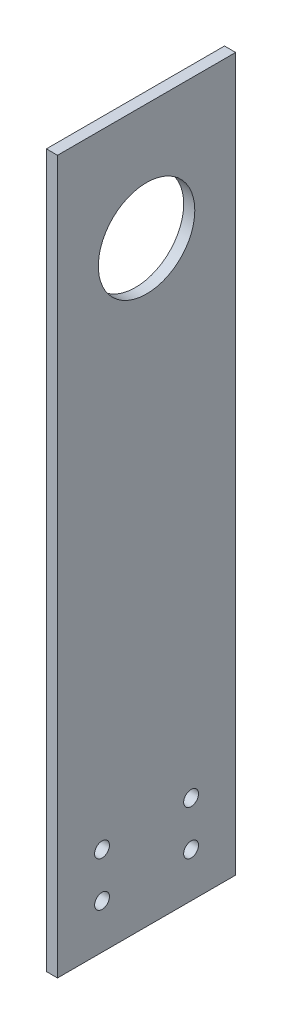
from build123d import *

# Parameters (mm, degrees)
SKETCH1_W           = 76.2
SKETCH1_H           = 304.8
BOSS_EXTRUDE1_DEPTH = 4.7625
CUT_EXTRUDE1_REACH  = 159.163
SKETCH2_R           = 20.6375
CUT_EXTRUDE2_REACH  = 159.163
SKETCH4_R           = 3.175


with BuildPart() as part:
    # Sketch1 → Boss-Extrude1 (new body)
    with BuildSketch(Plane(origin=(0, 0, 0), x_dir=(0, 0, -1), z_dir=(1, 0, 0))):
        Rectangle(SKETCH1_W, SKETCH1_H)
    extrude(amount=BOSS_EXTRUDE1_DEPTH)

    # Sketch2 → Cut-Extrude1 (cut, up to next)
    with BuildSketch(Plane(origin=(4.7625, 0, 0), x_dir=(0, 0, -1), z_dir=(1, 0, 0)), mode=Mode.PRIVATE) as cut_extrude1_sk1:
        with Locations((0, 102.616)):
            Circle(SKETCH2_R)
    cut_extrude1_tool1 = extrude(cut_extrude1_sk1.sketch, amount=-CUT_EXTRUDE1_REACH, mode=Mode.PRIVATE) & part.part
    add(cut_extrude1_tool1.solids().sort_by_distance((4.7625, 102.616, 0))[0], mode=Mode.SUBTRACT)

    # Sketch4 → Cut-Extrude2 (cut, up to next)
    with BuildSketch(Plane(origin=(4.7625, 0, 0), x_dir=(0, 0, -1), z_dir=(1, 0, 0)), mode=Mode.PRIVATE) as cut_extrude2_sk1:
        with Locations((-19.05, -114.3)):
            Circle(SKETCH4_R)
    cut_extrude2_tool1 = extrude(cut_extrude2_sk1.sketch, amount=-CUT_EXTRUDE2_REACH, mode=Mode.PRIVATE) & part.part
    # Sketch4 → Cut-Extrude2 (cut, up to next)
    with BuildSketch(Plane(origin=(4.7625, 0, 0), x_dir=(0, 0, -1), z_dir=(1, 0, 0)), mode=Mode.PRIVATE) as cut_extrude2_sk2:
        with Locations((19.05, -114.3)):
            Circle(SKETCH4_R)
    cut_extrude2_tool2 = extrude(cut_extrude2_sk2.sketch, amount=-CUT_EXTRUDE2_REACH, mode=Mode.PRIVATE) & part.part
    # Sketch4 → Cut-Extrude2 (cut, up to next)
    with BuildSketch(Plane(origin=(4.7625, 0, 0), x_dir=(0, 0, -1), z_dir=(1, 0, 0)), mode=Mode.PRIVATE) as cut_extrude2_sk3:
        with Locations((19.05, -133.35)):
            Circle(SKETCH4_R)
    cut_extrude2_tool3 = extrude(cut_extrude2_sk3.sketch, amount=-CUT_EXTRUDE2_REACH, mode=Mode.PRIVATE) & part.part
    # Sketch4 → Cut-Extrude2 (cut, up to next)
    with BuildSketch(Plane(origin=(4.7625, 0, 0), x_dir=(0, 0, -1), z_dir=(1, 0, 0)), mode=Mode.PRIVATE) as cut_extrude2_sk4:
        with Locations((-19.05, -133.35)):
            Circle(SKETCH4_R)
    cut_extrude2_tool4 = extrude(cut_extrude2_sk4.sketch, amount=-CUT_EXTRUDE2_REACH, mode=Mode.PRIVATE) & part.part
    add(cut_extrude2_tool1.solids().sort_by_distance((4.7625, -114.3, 19.05))[0], mode=Mode.SUBTRACT)
    add(cut_extrude2_tool2.solids().sort_by_distance((4.7625, -114.3, -19.05))[0], mode=Mode.SUBTRACT)
    add(cut_extrude2_tool3.solids().sort_by_distance((4.7625, -133.35, -19.05))[0], mode=Mode.SUBTRACT)
    add(cut_extrude2_tool4.solids().sort_by_distance((4.7625, -133.35, 19.05))[0], mode=Mode.SUBTRACT)


solid = part.part
